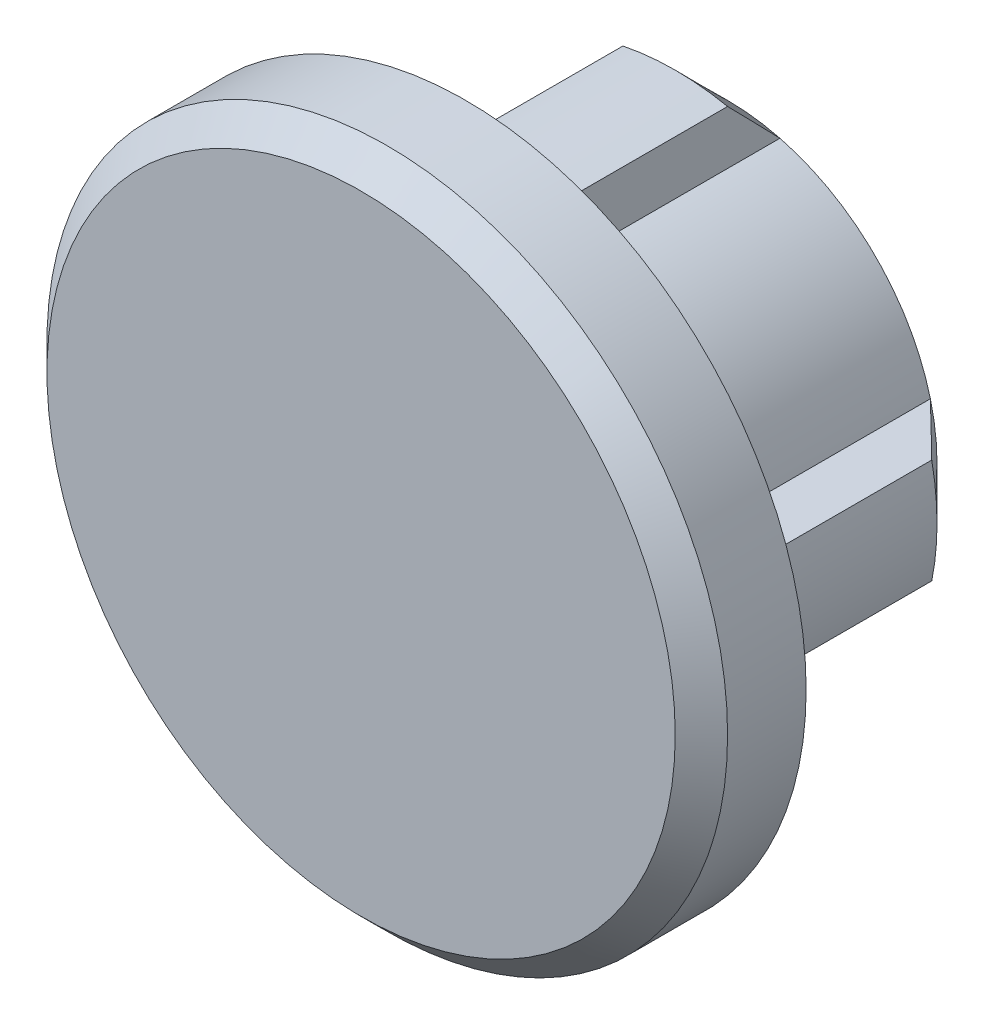
from build123d import *
from build123d.topology import SkipClean

# Parameters (mm, degrees)
SKETCH1_R           = 5
SKETCH1_R_2         = 2.5
BOSS_EXTRUDE1_DEPTH = 5
SKETCH2_R           = 6.5
BOSS_EXTRUDE2_DEPTH = 2
CHAMFER1_SIZE       = 0.5
CUT_EXTRUDE1_DEPTH  = 0.5
CUT_EXTRUDE2_DEPTH  = 5


with BuildPart() as part:
    # Sketch1 → Boss-Extrude1 (new body)
    with BuildSketch(Plane.XY):
        Circle(SKETCH1_R)
        Circle(SKETCH1_R_2, mode=Mode.SUBTRACT)
    extrude(amount=-BOSS_EXTRUDE1_DEPTH)

    # Sketch2 → Boss-Extrude2 (add)
    with BuildSketch(Plane.XY):
        Circle(SKETCH2_R)
    extrude(amount=BOSS_EXTRUDE2_DEPTH)

    # Chamfer1
    chamfer1_edges = [part.edges().sort_by_distance(p)[0] for p in [
        (-6.5, 0, 2),
    ]]
    chamfer(chamfer1_edges, length=CHAMFER1_SIZE)

    # Sketch3 → Cut-Extrude1 (cut)
    with SkipClean():  # the faces are left unmerged after this step: merging them gives an invalid solid
        with BuildSketch(Plane(origin=(0, 0, 0), x_dir=(-1, 0, 0), z_dir=(0, 0, -1))):
            with BuildLine():
                Line((4.582575695, 2), (6.184658438, 2))
                ThreePointArc((6.184658438, 2), (6.5, 0), (6.184658438, -2))
                Line((6.184658438, -2), (4.582575695, -2))
                ThreePointArc((4.582575695, -2), (5, 0), (4.582575695, 2))
            make_face()
        extrude(amount=-CUT_EXTRUDE1_DEPTH, mode=Mode.SUBTRACT)

    # Sketch4 → Cut-Extrude2 (cut)
    with SkipClean():  # the faces are left unmerged after this step: merging them gives an invalid solid
        with BuildSketch(Plane(origin=(0, 0, -5), x_dir=(-1, 0, 0), z_dir=(0, 0, -1))):
            with BuildLine():
                Line((-1, 4.898979486), (-1, 3.872983346))
                ThreePointArc((-1, 3.872983346), (-2.828427125, 2.828427125), (-3.872983346, 1))
                Line((-3.872983346, 1), (-4.898979486, 1))
                ThreePointArc((-4.898979486, 1), (-3.535533906, 3.535533906), (-1, 4.898979486))
            make_face()
            with BuildLine():
                Line((1, 4.898979486), (1, 3.872983346))
                ThreePointArc((1, 3.872983346), (2.828427125, 2.828427125), (3.872983346, 1))
                Line((3.872983346, 1), (4.898979486, 1))
                ThreePointArc((4.898979486, 1), (3.535533906, 3.535533906), (1, 4.898979486))
            make_face()
            with BuildLine():
                Line((4.898979486, -1), (3.872983346, -1))
                ThreePointArc((3.872983346, -1), (2.828427125, -2.828427125), (1, -3.872983346))
                Line((1, -3.872983346), (1, -4.898979486))
                ThreePointArc((1, -4.898979486), (3.535533906, -3.535533906), (4.898979486, -1))
            make_face()
            with BuildLine():
                Line((-3.872983346, -1), (-4.898979486, -1))
                ThreePointArc((-4.898979486, -1), (-3.535533906, -3.535533906), (-1, -4.898979486))
                Line((-1, -4.898979486), (-1, -3.872983346))
                ThreePointArc((-1, -3.872983346), (-2.828427125, -2.828427125), (-3.872983346, -1))
            make_face()
        extrude(amount=-CUT_EXTRUDE2_DEPTH, mode=Mode.SUBTRACT)

    # Chamfer2: read off the stored shape, not the designer's step
    # Chamfer2 outline → Chamfer2 (revolve, cut)
    with SkipClean():  # the faces are left unmerged after this step: merging them gives an invalid solid
        with BuildSketch(Plane.XZ):
            Polygon((5, -4), (4, -5), (5, -5), align=None)
        revolve(axis=Axis((0, 0, 0), (0, 0, 1)), mode=Mode.SUBTRACT)


solid = part.part
